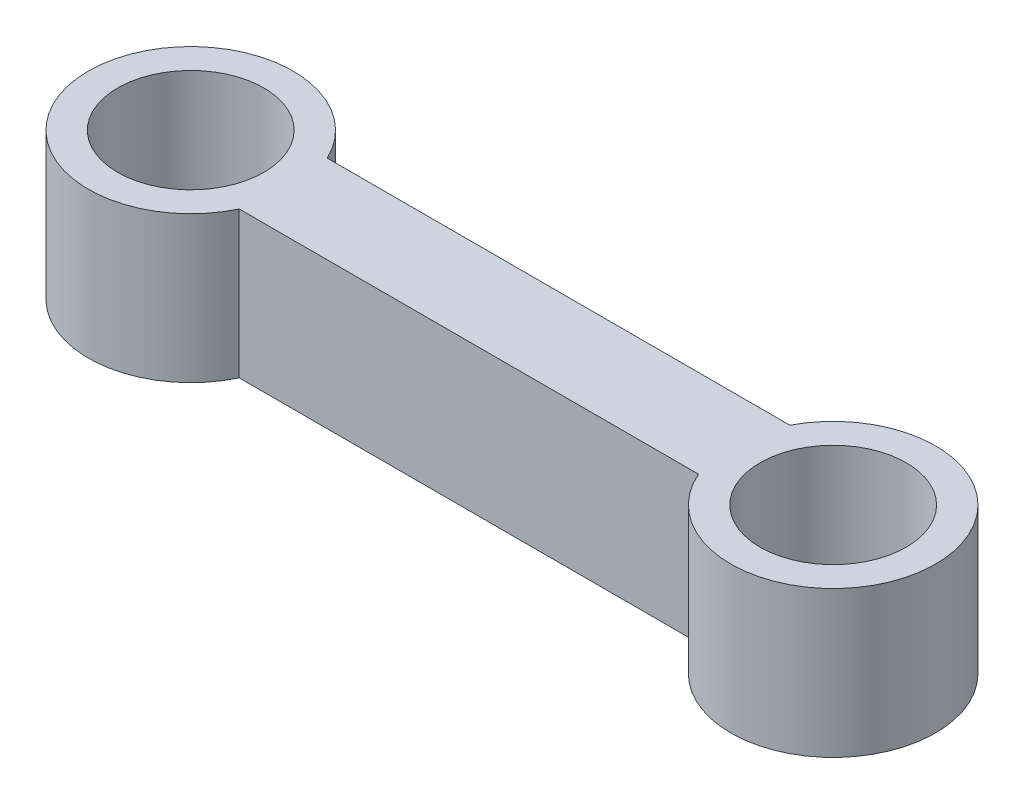
from build123d import *

# Parameters (mm, degrees)
BOSS_EXTRU_2_DEPTH      = 100
ESQUISSE2_R             = 50
ENL_V_MAT_EXTRU_2_DEPTH = 95
ESQUISSE4_R             = 50
ENL_V_MAT_EXTRU_3_DEPTH = 527.130239045


with BuildPart() as part:
    # Esquisse1 → Boss.-Extru.2 (new body)
    with BuildSketch(Plane(origin=(0, 0, 0), x_dir=(1, 0, 0), z_dir=(0, 1, 0))):
        with BuildLine():
            Line((379.401849177, 30.095541494), (63.200145428, 30.095541494))
            ThreePointArc((63.200145428, 30.095541494), (-70, 0), (63.200145428, -30.095541494))
            Line((63.200145428, -30.095541494), (377.209706533, -30.095541494))
            ThreePointArc((377.209706533, -30.095541494), (511.408174051, -4.847552565), (379.401849177, 30.095541494))
        make_face()
    extrude(amount=BOSS_EXTRU_2_DEPTH)

    # Esquisse2 → Enlèv. mat.-Extru.2 (cut)
    with BuildSketch(Plane(origin=(0, 100, 0), x_dir=(1, 0, 0), z_dir=(0, 1, 0))):
        Circle(ESQUISSE2_R)
    extrude(amount=-ENL_V_MAT_EXTRU_2_DEPTH, mode=Mode.SUBTRACT)

    # Esquisse4 → Enlèv. mat.-Extru.3 (cut, through all)
    with BuildSketch(Plane(origin=(0, 100, 0), x_dir=(1, 0, 0), z_dir=(0, 1, 0))):
        with Locations((441.45455179, -2.299860933)):
            Circle(ESQUISSE4_R)
    extrude(amount=-ENL_V_MAT_EXTRU_3_DEPTH, mode=Mode.SUBTRACT)


solid = part.part
